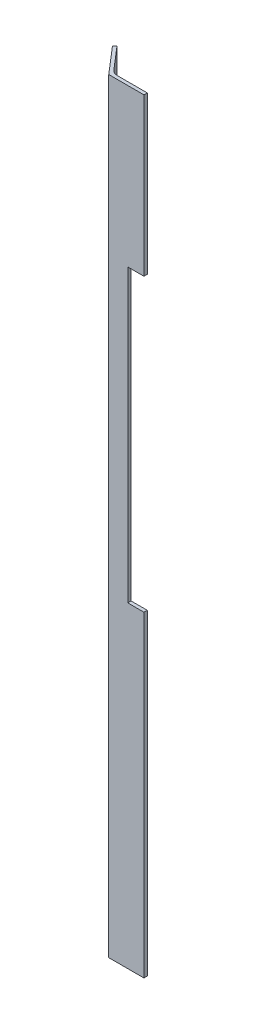
from build123d import *

# Parameters (mm, degrees)
EXTRUDE_START       = 40
EXTRUDE_1_DEPTH     = 460
SKETCH_2_W          = 13.894074778
SKETCH_2_H          = 174.961932369
CUT_EXTRUDE_1_DEPTH = 501.611575003


with BuildPart() as part:
    # Эскиз1 → Вытянуть1 (new body)
    with BuildSketch(Plane(origin=(0, 0, 0), x_dir=(1, 0, 0), z_dir=(0, 1, 0)).offset(EXTRUDE_START)):
        with BuildLine():
            Line((-17.766709847, 14.4460477), (-16.308397656, 15.700046652))
            Line((-16.308397656, 15.700046652), (-4.722880617, 2.226908794))
            ThreePointArc((-4.722880617, 2.226908794), (-3.017444081, 0.942662024), (-0.931762463, 0.48688167))
            Line((-0.931762463, 0.48688167), (17.122829042, 0.48688167))
            Line((17.122829042, 0.48688167), (17.122829042, -1.51311833))
            Line((17.122829042, -1.51311833), (-4.043463493, -1.51311833))
            Line((-4.043463493, -1.51311833), (-17.766709847, 14.4460477))
        make_face()
    extrude(amount=EXTRUDE_1_DEPTH)

    # Эскиз2 → Вырез-Вытянуть1 (cut, through all)
    with BuildSketch(Plane.XY.offset(1.51311833)):
        with Locations((14.358074434, 318.010314184)):
            Rectangle(SKETCH_2_W, SKETCH_2_H)
    extrude(amount=-CUT_EXTRUDE_1_DEPTH, mode=Mode.SUBTRACT)


solid = part.part
